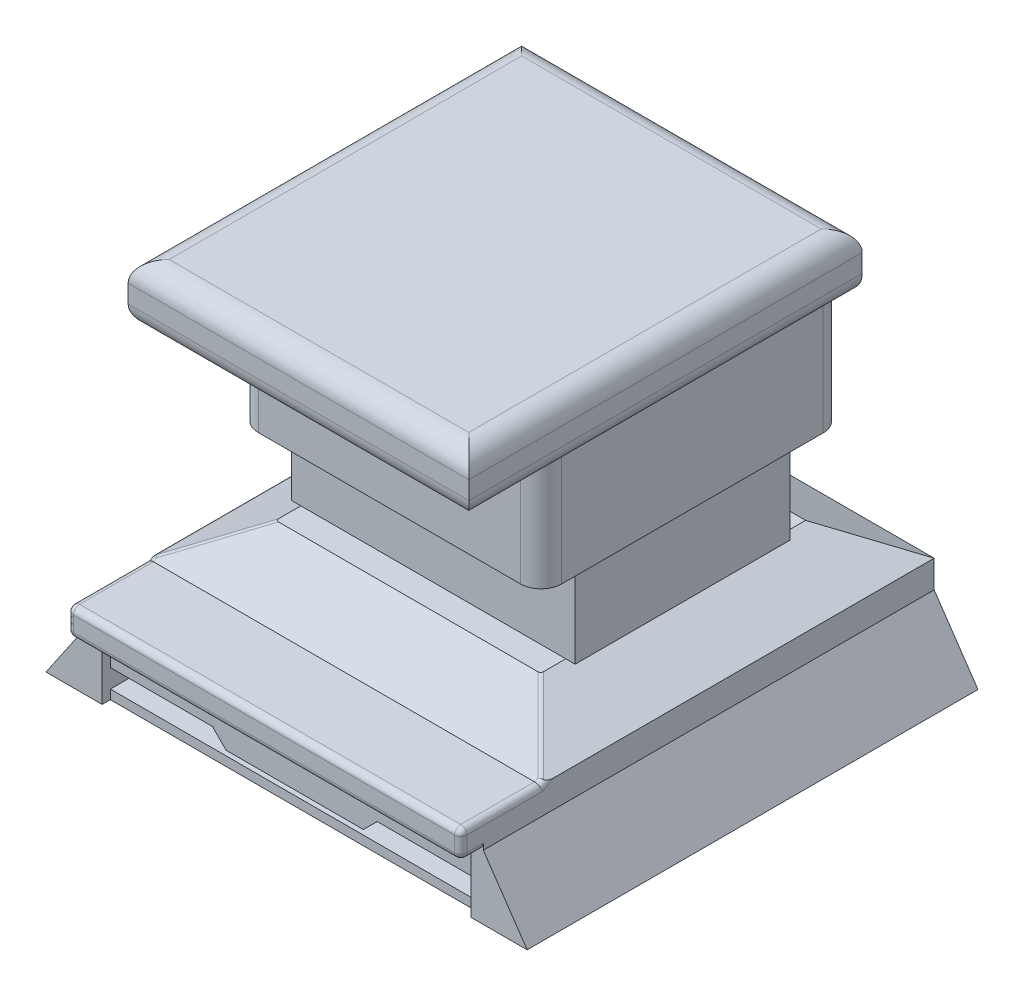
from build123d import *

# Parameters (mm, degrees)
SKETCH3_W            = 18.796
SKETCH3_H            = 18.7452
BOSS_EXTRUDE1_DEPTH  = 7.239
SKETCH4_W            = 21.1074
SKETCH4_H            = 24.384
BOSS_EXTRUDE2_DEPTH  = 3.6576
FILLET1_R            = 1.27
FILLET2_R            = 1.27
SKETCH5_W            = 17.5768
SKETCH5_H            = 13.3096
BOSS_EXTRUDE3_DEPTH  = 5.334
SKETCH13_W           = 24.384
SKETCH13_H           = 24.384
BOSS_EXTRUDE10_DEPTH = 2.032
SKETCH15_W           = 24.384
SKETCH15_H           = 29.337
BOSS_EXTRUDE11_DEPTH = 1.7018
BOSS_EXTRUDE12_DEPTH = 27.94
FILLET3_R            = 1.27
FILLET4_R            = 0.381
VARFILLET2_R         = 0.381
VARFILLET3_R         = 0.381
FILLET5_R            = 0.381
FILLET6_R            = 0.381
SKETCH18_W           = 11.43
SKETCH18_H           = 0.57213832
CUT_EXTRUDE1_DEPTH   = 0.508
CUT_EXTRUDE2_DEPTH   = 7.112


with BuildPart() as part:
    # Sketch3 → Boss-Extrude1 (new body)
    with BuildSketch(Plane(origin=(0, 0, 0), x_dir=(1, 0, 0), z_dir=(0, 1, 0))):
        Rectangle(SKETCH3_W, SKETCH3_H)
    extrude(amount=BOSS_EXTRUDE1_DEPTH)

    # Sketch4 → Boss-Extrude2 (add)
    with BuildSketch(Plane(origin=(0, 7.239, 0), x_dir=(1, 0, 0), z_dir=(0, 1, 0))):
        with Locations((0, -2.8194)):
            Rectangle(SKETCH4_W, SKETCH4_H)
    extrude(amount=BOSS_EXTRUDE2_DEPTH)

    # Fillet1
    fillet1_edges = [part.edges().sort_by_distance(p)[0] for p in [
        (0, 10.8966, -9.3726),
        (10.5537, 10.8966, 2.8194),
        (0, 10.8966, 15.0114),
        (-10.5537, 10.8966, 2.8194),
    ]]
    fillet(fillet1_edges, radius=FILLET1_R)

    # Fillet2
    fillet2_edges = [part.edges().sort_by_distance(p)[0] for p in [
        (10.5537, 7.239, 2.8194),
        (-10.5537, 7.239, 2.8194),
        (0, 7.239, 15.0114),
    ]]
    fillet(fillet2_edges, radius=FILLET2_R)

    # Sketch5 → Boss-Extrude3 (add)
    with BuildSketch(Plane.XZ):
        Rectangle(SKETCH5_W, SKETCH5_H)
    extrude(amount=BOSS_EXTRUDE3_DEPTH)

    # Sketch13 → Boss-Extrude10 (add)
    with BuildSketch(Plane.XZ.offset(5.334)):
        Rectangle(SKETCH13_W, SKETCH13_H)
    extrude(amount=BOSS_EXTRUDE10_DEPTH)

    # Cut-Sweep1: sweep along a path in Sketch13<2>
    with BuildLine(Plane.XZ.offset(5.334)) as cut_sweep1_path:
        Line((-12.192, 12.192), (12.192, 12.192))
        Line((12.192, 12.192), (12.192, -12.192))
        Line((12.192, -12.192), (-12.192, -12.192))
        Line((-12.192, -12.192), (-12.192, 12.192))
    # Sketch14 → Cut-Sweep1 (sweep, cut)
    with BuildSketch(Plane(origin=(12.192, 0, 0), x_dir=(0, 0, -1), z_dir=(1, 0, 0))):
        Polygon((-12.192, -5.334), (-12.192, -7.366), (-8.210109474, -5.334), align=None)
    sweep(path=cut_sweep1_path.line, transition=Transition.RIGHT, mode=Mode.SUBTRACT)

    # Sketch15 → Boss-Extrude11 (add)
    with BuildSketch(Plane.XZ.offset(7.366)):
        with Locations((0, 2.4765)):
            Rectangle(SKETCH15_W, SKETCH15_H)
    extrude(amount=BOSS_EXTRUDE11_DEPTH)

    # Sketch16 → Boss-Extrude12 (add)
    with BuildSketch(Plane(origin=(0, 0, -12.192), x_dir=(-1, 0, 0), z_dir=(0, 0, -1))):
        Polygon((-12.192, -9.0678), (-14.9098, -13.05576178), (14.9098, -13.05576178), (12.192, -9.0678), align=None)
    extrude(amount=-BOSS_EXTRUDE12_DEPTH)

    # Fillet3
    fillet3_edges = [part.edges().sort_by_distance(p)[0] for p in [
        (-9.398, 3.622076979, 9.3726),
        (-9.398, 3.622076979, -9.3726),
        (9.398, 3.622076979, -9.3726),
        (9.398, 3.622076979, 9.3726),
    ]]
    fillet(fillet3_edges, radius=FILLET3_R)

    # Fillet4
    fillet4_edges = [part.edges().sort_by_distance(p)[0] for p in [
        (0, -7.366, 17.145),
    ]]
    fillet(fillet4_edges, radius=FILLET4_R)

    # VarFillet2
    varfillet2_edges = [part.edges().sort_by_distance(p)[0] for p in [
        (-12.192, -9.0678, 16.4465),
        (-12.192, -8.4074, 17.145),
        (0, -9.0678, 17.145),
    ]]
    fillet(varfillet2_edges, radius=VARFILLET2_R)

    # VarFillet3
    varfillet3_edges = [part.edges().sort_by_distance(p)[0] for p in [
        (12.192, -9.0678, 16.256),
    ]]
    fillet(varfillet3_edges, radius=VARFILLET3_R)

    # Fillet5
    fillet5_edges = [part.edges().sort_by_distance(p)[0] for p in [
        (-12.192, -7.366, 0),
        (-12.192, -7.5565, 12.565302237),
        (-10.201054737, -6.35, 10.201054737),
    ]]
    fillet(fillet5_edges, radius=FILLET5_R)

    # Fillet6
    fillet6_edges = [part.edges().sort_by_distance(p)[0] for p in [
        (10.201054737, -6.35, 10.201054737),
        (12.192, -7.5565, 12.565302237),
    ]]
    fillet(fillet6_edges, radius=FILLET6_R)

    # Sketch18 → Cut-Extrude1 (cut)
    with BuildSketch(Plane.XY.offset(15.748)):
        Polygon((0, -9.0678), (-11.43, -9.0678), (-11.43, -11.328362841), (-5.08, -11.328362841), (-5.08, -11.355465108), (-4.2545, -12.180965108), (0, -12.180965108), align=None)
        with Locations((-5.715, -12.76969262)):
            Rectangle(SKETCH18_W, SKETCH18_H)
    cut_extrude1 = extrude(amount=-CUT_EXTRUDE1_DEPTH, mode=Mode.SUBTRACT)

    # Sketch18<4> → Cut-Extrude2 (cut)
    with BuildSketch(Plane.XY.offset(15.748)):
        Polygon((-5.08, -11.328362841), (-11.43, -11.328362841), (-11.43, -12.48362346), (0, -12.48362346), (0, -12.180965108), (-4.2545, -12.180965108), (-5.08, -11.355465108), align=None)
    cut_extrude2 = extrude(amount=-CUT_EXTRUDE2_DEPTH, mode=Mode.SUBTRACT)

    # Mirror1: Cut-Extrude1, Cut-Extrude2 across plane
    add(cut_extrude1.mirror(Plane(origin=(0, 0, 0), x_dir=(0, 0, 1), z_dir=(1, 0, 0))), mode=Mode.SUBTRACT)
    add(cut_extrude2.mirror(Plane(origin=(0, 0, 0), x_dir=(0, 0, 1), z_dir=(1, 0, 0))), mode=Mode.SUBTRACT)


solid = part.part
